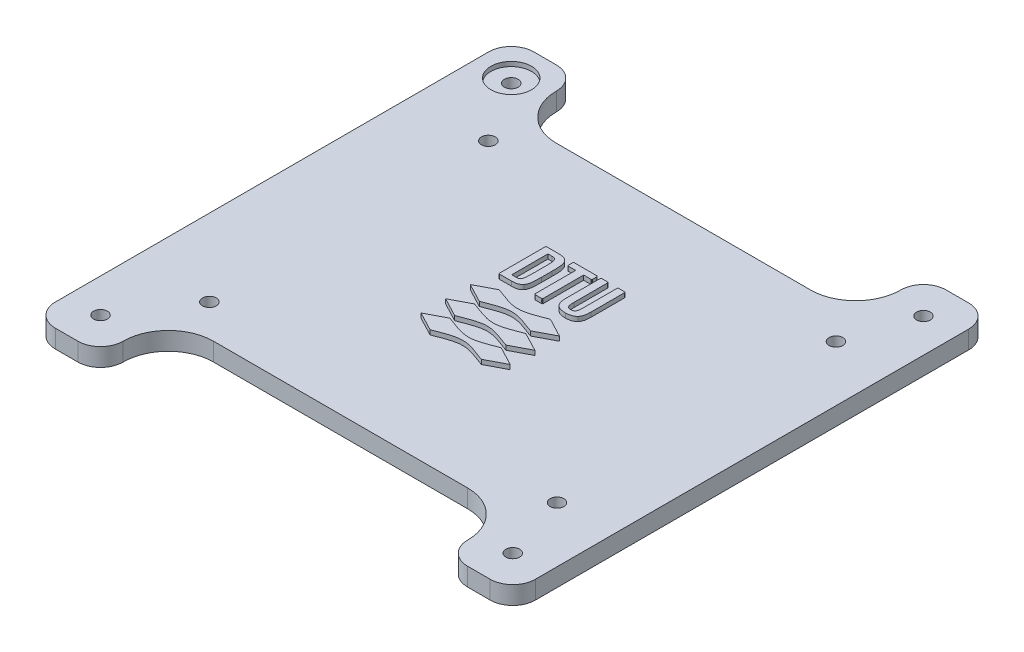
from build123d import *
from OCP.BRepFilletAPI import BRepFilletAPI_MakeFillet

# Parameters (mm, degrees)
BOSS_EXTRUDE1_DEPTH = 4
SKETCH2_R           = 1.525
CUT_EXTRUDE3_DEPTH  = 119.30157091
FILLET1_R           = 10
FILLET1_R_2         = 5
SKETCH5_R           = 1.525
CUT_EXTRUDE4_DEPTH  = 10
SKETCH5_3_R         = 4.5
CUT_EXTRUDE5_DEPTH  = 1
BOSS_EXTRUDE3_DEPTH = 1


with BuildPart() as part:
    # Sketch1 → Boss-Extrude1 (new body)
    with BuildSketch(Plane(origin=(0, 0, 0), x_dir=(1, 0, 0), z_dir=(0, 1, 0))):
        Polygon((-54.512495659, 74.585236211), (-54.512495659, 28.735236211), (-54.512495659, 14.067346025), (-54.512495659, -0.932653975), (-39.512495659, -0.932653975), (-39.512495659, 14.067346025), (36.687504341, 14.067346025), (36.687504341, -0.932653975), (51.687504341, -0.932653975), (51.687504341, 14.067346025), (51.687504341, 26.613844373), (51.687504341, 72.463844373), (51.687504341, 89.917346025), (51.687504341, 104.917346025), (36.687504341, 104.917346025), (36.687504341, 89.917346025), (-39.512495659, 89.917346025), (-39.512495659, 104.917346025), (-54.512495659, 104.917346025), (-54.512495659, 89.917346025), align=None)
    extrude(amount=BOSS_EXTRUDE1_DEPTH)

    # Sketch2 → Cut-Extrude3 (cut, through all)
    with BuildSketch(Plane(origin=(0, 4, 0), x_dir=(1, 0, 0), z_dir=(0, 1, 0))):
        with Locations(Location((39.397504341, 82.847346025, 0), (0, 0, 270))):
            Circle(SKETCH2_R)
        with Locations(Location((-37.502495659, 82.847346025, 0), (0, 0, 270))):
            Circle(SKETCH2_R)
        with Locations(Location((-37.502495659, 21.137346025, 0), (0, 0, 270))):
            Circle(SKETCH2_R)
        with Locations(Location((39.397504341, 21.137346025, 0), (0, 0, 270))):
            Circle(SKETCH2_R)
    extrude(amount=-CUT_EXTRUDE3_DEPTH, mode=Mode.SUBTRACT)

    # Fillet1
    fillet1_edges_1 = [part.edges().sort_by_distance(p)[0] for p in [
        (-39.512495659, 2, -89.917346025),
        (36.687504341, 2, -89.917346025),
        (-39.512495659, 2, -14.067346025),
        (36.687504341, 2, -14.067346025),
    ]]
    fillet1_edges_2 = [part.edges().sort_by_distance(p)[0] for p in [
        (-39.512495659, 2, -104.917346025),
        (-54.512495659, 2, -104.917346025),
        (36.687504341, 2, -104.917346025),
        (51.687504341, 2, -104.917346025),
        (-39.512495659, 2, 0.932653975),
        (-54.512495659, 2, 0.932653975),
        (36.687504341, 2, 0.932653975),
        (51.687504341, 2, 0.932653975),
    ]]
    fillet1 = BRepFilletAPI_MakeFillet(part.part.solid().wrapped)
    for e in fillet1_edges_1:
        fillet1.Add(FILLET1_R - 0.0001, e.wrapped)
    for e in fillet1_edges_2:
        fillet1.Add(FILLET1_R_2 - 0.0001, e.wrapped)
    add(Compound.cast(fillet1.Shape()), mode=Mode.REPLACE)  # a hair under: the kernel refuses the full size

    # Sketch5 → Cut-Extrude4 (cut)
    with BuildSketch(Plane(origin=(0, 4, 0), x_dir=(1, 0, 0), z_dir=(0, 1, 0))):
        with Locations(Location((-47.012495659, 97.417346025, 0), (0, 0, 270))):
            Circle(SKETCH5_R)
        with Locations(Location((-47.012495659, 6.567346025, 0), (0, 0, 270))):
            Circle(SKETCH5_R)
        with Locations(Location((44.187504341, 6.567346025, 0), (0, 0, 270))):
            Circle(SKETCH5_R)
        with Locations(Location((44.187504341, 97.417346025, 0), (0, 0, 270))):
            Circle(SKETCH5_R)
    extrude(amount=-CUT_EXTRUDE4_DEPTH, mode=Mode.SUBTRACT)

    # Sketch5<3> → Cut-Extrude5 (cut)
    with BuildSketch(Plane(origin=(0, 4, 0), x_dir=(1, 0, 0), z_dir=(0, 1, 0))):
        with Locations(Location((-47.012495659, 97.417346025, 0), (0, 0, 270))):
            Circle(SKETCH5_3_R)
    extrude(amount=-CUT_EXTRUDE5_DEPTH, mode=Mode.SUBTRACT)

    # Sketch13 → Boss-Extrude3 (add)
    # profile 1 of 6: a face of its own
    with BuildSketch(Plane(origin=(-31.128581926, 4, 4), x_dir=(-1, 0, 0), z_dir=(0, -1, 0))):
        with BuildLine():
            Line((-35.690135843, 58.524933479), (-39.889073342, 56.319300667))
            Line((-39.889073342, 56.319300667), (-35.690135843, 54.116644417))
            add(Edge.make_bspline(
                [(-35.690135843, 54.116644417), (-30.253940532, 56.230995979), (-29.795053813, 56.230995979), (-24.356874127, 54.116644417)],
                knots=[1, 1, 1, 1, 2, 2, 2, 2], degree=3))
            Line((-24.356874127, 54.116644417), (-20.158928816, 56.319300667))
            Line((-20.158928816, 56.319300667), (-24.356874127, 58.524933479))
            add(Edge.make_bspline(
                [(-24.356874127, 58.524933479), (-29.795053813, 56.409589729), (-30.253940532, 56.409589729), (-35.690135843, 58.524933479)],
                knots=[4, 4, 4, 4, 5, 5, 5, 5], degree=3))
        make_face()
    # profile 2 of 6: a face of its own
    with BuildSketch(Plane(origin=(-31.128581926, 4, 4), x_dir=(-1, 0, 0), z_dir=(0, -1, 0))):
        with BuildLine():
            Line((-35.690135843, 53.07583973), (-39.889073342, 50.872191293))
            Line((-39.889073342, 50.872191293), (-35.690135843, 48.667550669))
            add(Edge.make_bspline(
                [(-35.690135843, 48.667550669), (-30.253940532, 50.782894418), (-29.795053813, 50.782894418), (-24.356874127, 48.667550669)],
                knots=[1, 1, 1, 1, 2, 2, 2, 2], degree=3))
            Line((-24.356874127, 48.667550669), (-20.158928816, 50.872191293))
            Line((-20.158928816, 50.872191293), (-24.356874127, 53.07583973))
            add(Edge.make_bspline(
                [(-24.356874127, 53.07583973), (-29.795053813, 50.961488168), (-30.253940532, 50.961488168), (-35.690135843, 53.07583973)],
                knots=[4, 4, 4, 4, 5, 5, 5, 5], degree=3))
        make_face()
    # profile 3 of 6: a face of its own
    with BuildSketch(Plane(origin=(-31.128581926, 4, 4), x_dir=(-1, 0, 0), z_dir=(0, -1, 0))):
        with BuildLine():
            Line((-35.690135843, 47.627738169), (-39.889073342, 45.424089732))
            Line((-39.889073342, 45.424089732), (-35.690135843, 43.220441295))
            add(Edge.make_bspline(
                [(-35.690135843, 43.220441295), (-30.253940532, 45.334792857), (-29.795053813, 45.334792857), (-24.356874127, 43.220441295)],
                knots=[1, 1, 1, 1, 2, 2, 2, 2], degree=3))
            Line((-24.356874127, 43.220441295), (-20.158928816, 45.424089732))
            Line((-20.158928816, 45.424089732), (-24.356874127, 47.627738169))
            add(Edge.make_bspline(
                [(-24.356874127, 47.627738169), (-29.795053813, 45.51239442), (-30.253940532, 45.51239442), (-35.690135843, 47.627738169)],
                knots=[4, 4, 4, 4, 5, 5, 5, 5], degree=3))
        make_face()
    # profile 4 of 6: a face of its own
    with BuildSketch(Plane(origin=(-31.128581926, 4, 4), x_dir=(-1, 0, 0), z_dir=(0, -1, 0))):
        with BuildLine():
            Line((-24.048303815, 72.001816288), (-21.428928815, 72.001816288))
            add(Edge.make_bspline(
                [(-21.428928815, 72.001816288), (-21.350546003, 72.001816288), (-21.302424909, 71.978003788), (-21.267202253, 71.944269413)],
                knots=[0, 0, 0, 0, 1, 1, 1, 1], degree=3))
            add(Edge.make_bspline(
                [(-21.267202253, 71.944269413), (-21.23247569, 71.908550663), (-21.209655378, 71.86191785), (-21.209655378, 71.78254285)],
                knots=[1, 1, 1, 1, 2, 2, 2, 2], degree=3))
            Line((-21.209655378, 71.78254285), (-21.209655378, 61.769386603))
            add(Edge.make_bspline(
                [(-21.209655378, 61.769386603), (-21.209655378, 61.691003791), (-21.23247569, 61.643378791), (-21.267202253, 61.608652228)],
                knots=[3, 3, 3, 3, 4, 4, 4, 4], degree=3))
            add(Edge.make_bspline(
                [(-21.267202253, 61.608652228), (-21.302424909, 61.573925666), (-21.350546003, 61.550113166), (-21.428928815, 61.550113166)],
                knots=[4, 4, 4, 4, 5, 5, 5, 5], degree=3))
            Line((-21.428928815, 61.550113166), (-24.048303815, 61.550113166))
            add(Edge.make_bspline(
                [(-24.048303815, 61.550113166), (-25.065792096, 61.550113166), (-25.686405377, 61.781292853), (-26.062444439, 62.268456915)],
                knots=[6, 6, 6, 6, 7, 7, 7, 7], degree=3))
            add(Edge.make_bspline(
                [(-26.062444439, 62.268456915), (-26.617573345, 62.93322254), (-26.63543272, 64.006769415), (-26.63543272, 65.652808477)],
                knots=[7, 7, 7, 7, 8, 8, 8, 8], degree=3))
            Line((-26.63543272, 65.652808477), (-26.63543272, 67.899120976))
            add(Edge.make_bspline(
                [(-26.63543272, 67.899120976), (-26.63543272, 69.545160039), (-26.617573345, 70.618706913), (-26.062444439, 71.283472538)],
                knots=[9, 9, 9, 9, 10, 10, 10, 10], degree=3))
            add(Edge.make_bspline(
                [(-26.062444439, 71.283472538), (-25.686405377, 71.7706366), (-25.065792096, 72.001816288), (-24.048303815, 72.001816288)],
                knots=[10, 10, 10, 10, 11, 11, 11, 11], degree=3))
        make_face()
        with BuildLine():
            Line((-22.87156944, 62.772488165), (-22.87156944, 70.780433476))
            Line((-22.87156944, 70.780433476), (-23.795296002, 70.780433476))
            add(Edge.make_bspline(
                [(-23.795296002, 70.780433476), (-24.203085064, 70.780433476), (-24.446667096, 70.713956913), (-24.635182721, 70.487738163)],
                knots=[1, 1, 1, 1, 2, 2, 2, 2], degree=3))
            add(Edge.make_bspline(
                [(-24.635182721, 70.487738163), (-24.925893658, 70.138488163), (-24.950698346, 69.434035039), (-24.950698346, 68.014214726)],
                knots=[2, 2, 2, 2, 3, 3, 3, 3], degree=3))
            Line((-24.950698346, 68.014214726), (-24.950698346, 65.537714727))
            add(Edge.make_bspline(
                [(-24.950698346, 65.537714727), (-24.950698346, 64.117894415), (-24.925893658, 63.41344129), (-24.635182721, 63.06419129)],
                knots=[4, 4, 4, 4, 5, 5, 5, 5], degree=3))
            add(Edge.make_bspline(
                [(-24.635182721, 63.06419129), (-24.446667096, 62.83797254), (-24.203085064, 62.772488165), (-23.795296002, 62.772488165)],
                knots=[5, 5, 5, 5, 6, 6, 6, 6], degree=3))
            Line((-23.795296002, 62.772488165), (-22.87156944, 62.772488165))
        make_face(mode=Mode.SUBTRACT)
    # profile 5 of 6: a face of its own
    with BuildSketch(Plane(origin=(-31.128581926, 4, 4), x_dir=(-1, 0, 0), z_dir=(0, -1, 0))):
        with BuildLine():
            Line((-38.780799905, 64.387769415), (-38.780799905, 71.78254285))
            add(Edge.make_bspline(
                [(-38.780799905, 71.78254285), (-38.780799905, 71.86191785), (-38.756987405, 71.908550663), (-38.722260842, 71.944269413)],
                knots=[0, 0, 0, 0, 1, 1, 1, 1], degree=3))
            add(Edge.make_bspline(
                [(-38.722260842, 71.944269413), (-38.688030373, 71.978003788), (-38.639413186, 72.001816288), (-38.561526467, 72.001816288)],
                knots=[1, 1, 1, 1, 2, 2, 2, 2], degree=3))
            Line((-38.561526467, 72.001816288), (-37.337167092, 72.001816288))
            add(Edge.make_bspline(
                [(-37.337167092, 72.001816288), (-37.25878428, 72.001816288), (-37.21115928, 71.978003788), (-37.176432718, 71.944269413)],
                knots=[3, 3, 3, 3, 4, 4, 4, 4], degree=3))
            add(Edge.make_bspline(
                [(-37.176432718, 71.944269413), (-37.141210061, 71.908550663), (-37.117893655, 71.86191785), (-37.117893655, 71.78254285)],
                knots=[4, 4, 4, 4, 5, 5, 5, 5], degree=3))
            Line((-37.117893655, 71.78254285), (-37.117893655, 64.38975379))
            add(Edge.make_bspline(
                [(-37.117893655, 64.38975379), (-37.117893655, 63.618824103), (-37.059354593, 63.160433478), (-36.809323343, 62.884605353)],
                knots=[6, 6, 6, 6, 7, 7, 7, 7], degree=3))
            add(Edge.make_bspline(
                [(-36.809323343, 62.884605353), (-36.639163186, 62.698074103), (-36.398061624, 62.606792853), (-36.061710062, 62.606792853)],
                knots=[7, 7, 7, 7, 8, 8, 8, 8], degree=3))
            add(Edge.make_bspline(
                [(-36.061710062, 62.606792853), (-35.755124124, 62.606792853), (-35.523944437, 62.692120978), (-35.347335062, 62.886589728)],
                knots=[8, 8, 8, 8, 9, 9, 9, 9], degree=3))
            add(Edge.make_bspline(
                [(-35.347335062, 62.886589728), (-35.110202249, 63.14753504), (-35.038268656, 63.591042853), (-35.038268656, 64.38975379)],
                knots=[9, 9, 9, 9, 10, 10, 10, 10], degree=3))
            Line((-35.038268656, 64.38975379), (-35.038268656, 71.78254285))
            add(Edge.make_bspline(
                [(-35.038268656, 71.78254285), (-35.038268656, 71.86191785), (-35.013960062, 71.908550663), (-34.978737406, 71.944269413)],
                knots=[11, 11, 11, 11, 12, 12, 12, 12], degree=3))
            add(Edge.make_bspline(
                [(-34.978737406, 71.944269413), (-34.945003031, 71.978003788), (-34.896881937, 72.001816288), (-34.818003031, 72.001816288)],
                knots=[12, 12, 12, 12, 13, 13, 13, 13], degree=3))
            Line((-34.818003031, 72.001816288), (-33.594635843, 72.001816288))
            add(Edge.make_bspline(
                [(-33.594635843, 72.001816288), (-33.515756937, 72.001816288), (-33.467635843, 71.978003788), (-33.433901468, 71.944269413)],
                knots=[14, 14, 14, 14, 15, 15, 15, 15], degree=3))
            add(Edge.make_bspline(
                [(-33.433901468, 71.944269413), (-33.398182718, 71.908550663), (-33.375362406, 71.86191785), (-33.375362406, 71.78254285)],
                knots=[15, 15, 15, 15, 16, 16, 16, 16], degree=3))
            Line((-33.375362406, 71.78254285), (-33.375362406, 64.387769415))
            add(Edge.make_bspline(
                [(-33.375362406, 64.387769415), (-33.375362406, 63.311245978), (-33.521710062, 62.636558478), (-33.949342875, 62.166261603)],
                knots=[17, 17, 17, 17, 18, 18, 18, 18], degree=3))
            add(Edge.make_bspline(
                [(-33.949342875, 62.166261603), (-34.393346781, 61.677113166), (-35.065553812, 61.418152228), (-36.083042093, 61.418152228)],
                knots=[18, 18, 18, 18, 19, 19, 19, 19], degree=3))
            add(Edge.make_bspline(
                [(-36.083042093, 61.418152228), (-37.112436624, 61.418152228), (-37.775217874, 61.693980353), (-38.183006936, 62.16725379)],
                knots=[19, 19, 19, 19, 20, 20, 20, 20], degree=3))
            add(Edge.make_bspline(
                [(-38.183006936, 62.16725379), (-38.662233498, 62.723870978), (-38.780799905, 63.388636603), (-38.780799905, 64.387769415)],
                knots=[20, 20, 20, 20, 21, 21, 21, 21], degree=3))
        make_face()
    # profile 6 of 6: a face of its own
    with BuildSketch(Plane(origin=(-31.128581926, 4, 4), x_dir=(-1, 0, 0), z_dir=(0, -1, 0))):
        with BuildLine():
            Line((-30.877034282, 70.681214726), (-30.877034282, 61.769386603))
            add(Edge.make_bspline(
                [(-30.877034282, 61.769386603), (-30.877034282, 61.691003791), (-30.854213969, 61.643378791), (-30.819487407, 61.608652228)],
                knots=[0, 0, 0, 0, 1, 1, 1, 1], degree=3))
            add(Edge.make_bspline(
                [(-30.819487407, 61.608652228), (-30.78426475, 61.573925666), (-30.73663975, 61.550113166), (-30.658753032, 61.550113166)],
                knots=[1, 1, 1, 1, 2, 2, 2, 2], degree=3))
            Line((-30.658753032, 61.550113166), (-29.318803813, 61.550113166))
            add(Edge.make_bspline(
                [(-29.318803813, 61.550113166), (-29.240917094, 61.550113166), (-29.192299907, 61.573925666), (-29.158069438, 61.608652228)],
                knots=[3, 3, 3, 3, 4, 4, 4, 4], degree=3))
            add(Edge.make_bspline(
                [(-29.158069438, 61.608652228), (-29.122350688, 61.643378791), (-29.099530376, 61.691003791), (-29.099530376, 61.769386603)],
                knots=[4, 4, 4, 4, 5, 5, 5, 5], degree=3))
            Line((-29.099530376, 61.769386603), (-29.099530376, 70.681214726))
            Line((-29.099530376, 70.681214726), (-27.527409282, 70.681214726))
            add(Edge.make_bspline(
                [(-27.527409282, 70.681214726), (-27.448530376, 70.681214726), (-27.40140147, 70.704035038), (-27.36568272, 70.738761601)],
                knots=[7, 7, 7, 7, 8, 8, 8, 8], degree=3))
            add(Edge.make_bspline(
                [(-27.36568272, 70.738761601), (-27.330956157, 70.773488163), (-27.307143657, 70.822105351), (-27.307143657, 70.900488163)],
                knots=[8, 8, 8, 8, 9, 9, 9, 9], degree=3))
            Line((-27.307143657, 70.900488163), (-27.307143657, 71.78254285))
            add(Edge.make_bspline(
                [(-27.307143657, 71.78254285), (-27.307143657, 71.86191785), (-27.330956157, 71.908550663), (-27.36568272, 71.944269413)],
                knots=[10, 10, 10, 10, 11, 11, 11, 11], degree=3))
            add(Edge.make_bspline(
                [(-27.36568272, 71.944269413), (-27.40140147, 71.978003788), (-27.448530376, 72.001816288), (-27.527409282, 72.001816288)],
                knots=[11, 11, 11, 11, 12, 12, 12, 12], degree=3))
            Line((-27.527409282, 72.001816288), (-32.449651469, 72.001816288))
            add(Edge.make_bspline(
                [(-32.449651469, 72.001816288), (-32.528530375, 72.001816288), (-32.576651469, 71.978003788), (-32.611874125, 71.944269413)],
                knots=[13, 13, 13, 13, 14, 14, 14, 14], degree=3))
            add(Edge.make_bspline(
                [(-32.611874125, 71.944269413), (-32.645112406, 71.908550663), (-32.669421, 71.86191785), (-32.669421, 71.78254285)],
                knots=[14, 14, 14, 14, 15, 15, 15, 15], degree=3))
            Line((-32.669421, 71.78254285), (-32.669421, 70.900488163))
            add(Edge.make_bspline(
                [(-32.669421, 70.900488163), (-32.669421, 70.822105351), (-32.645112406, 70.773488163), (-32.611874125, 70.738761601)],
                knots=[16, 16, 16, 16, 17, 17, 17, 17], degree=3))
            add(Edge.make_bspline(
                [(-32.611874125, 70.738761601), (-32.576651469, 70.704035038), (-32.528530375, 70.681214726), (-32.449651469, 70.681214726)],
                knots=[17, 17, 17, 17, 18, 18, 18, 18], degree=3))
            Line((-32.449651469, 70.681214726), (-30.877034282, 70.681214726))
        make_face()
    extrude(amount=-BOSS_EXTRUDE3_DEPTH)


solid = part.part
